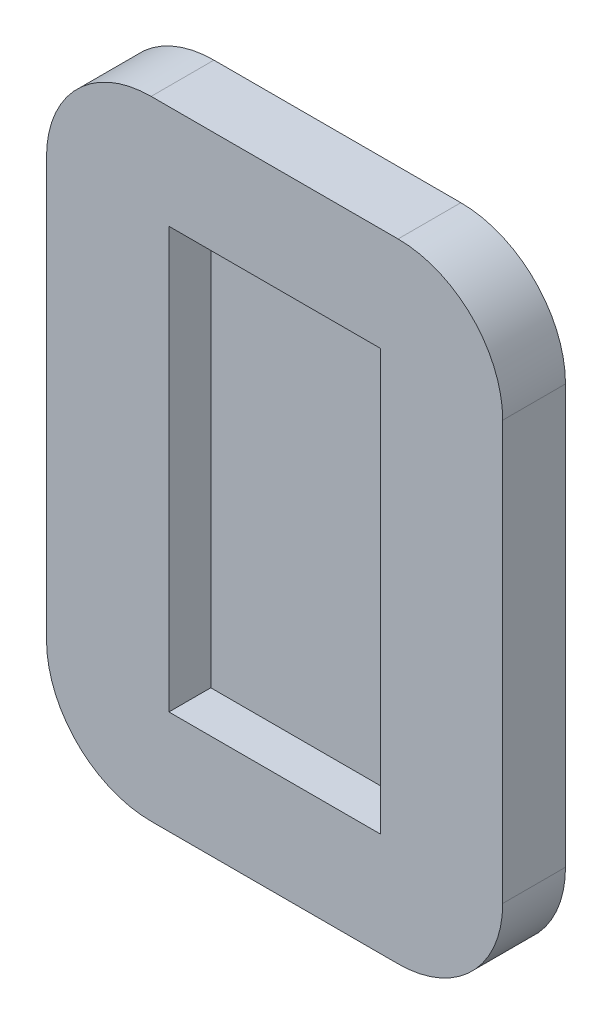
from build123d import *

# Parameters (mm, degrees)
CROQUIS1_W                        = 21.8
CROQUIS1_H                        = 30
SALIENTE_EXTRUIR1_DEPTH           = 21.8
CROQUIS6_R                        = 2
CORTAR_EXTRUIR2_DEPTH             = 21.8
CORTAR_EXTRUIR4_REACH             = 45.017
CROQUIS11_R                       = 3.5
CROQUIS11_W                       = 3.4
CROQUIS11_H                       = 8.4
CORTAR_EXTRUIR4_DIRECTION_2_DEPTH = 3.5
REDONDEO1_R                       = 5
CROQUIS13_R                       = 3.5
CORTAR_EXTRUIR6_DEPTH             = 3.5
CROQUIS16_W                       = 10.1
CROQUIS16_H                       = 20.1
CORTAR_EXTRUIR7_DEPTH             = 2
CROQUIS17_W                       = 10.1
CROQUIS17_H                       = 20.1
CORTAR_EXTRUIR8_DEPTH             = 2.1
CORTAR_EXTRUIR9_START             = -3.5
CROQUIS7_R                        = 3.5
CORTAR_EXTRUIR9_DEPTH             = 3.5
CORTAR_EXTRUIR10_REACH            = 45.017
CROQUIS18_W                       = 18.8
CROQUIS18_H                       = 30


with BuildPart() as part:
    # Croquis1 → Saliente-Extruir1 (new body)
    with BuildSketch(Plane(origin=(0, 0, 0), x_dir=(0, 0, -1), z_dir=(1, 0, 0))):
        with Locations((-10.9, -15)):
            Rectangle(CROQUIS1_W, CROQUIS1_H)
    extrude(amount=SALIENTE_EXTRUIR1_DEPTH)

    # Croquis6 → Cortar-Extruir2 (cut)
    with BuildSketch(Plane.ZY):
        with Locations((10.9, -22)):
            Circle(CROQUIS6_R)
        with Locations((10.9, -7)):
            Circle(CROQUIS6_R)
    extrude(amount=-CORTAR_EXTRUIR2_DEPTH, mode=Mode.SUBTRACT)

    # Cortar-Extruir4: up to this face of the body (flat: up to its plane)
    cortar_extruir4_end = Plane(part.part.faces().sort_by_distance((10.9, 0, 10.9))[0])
    # Croquis11 → Cortar-Extruir4 (cut, up to the picked face)
    with BuildSketch(Plane.XZ.offset(30), mode=Mode.PRIVATE) as cortar_extruir4_sk1:
        with Locations(Location((13.4, 10.9, 0), (0, 0, 270))):
            Circle(CROQUIS11_R)
    cortar_extruir4_tool1 = split(extrude(cortar_extruir4_sk1.sketch, amount=-CORTAR_EXTRUIR4_REACH, mode=Mode.PRIVATE), bisect_by=cortar_extruir4_end, keep=Keep.BOTH, mode=Mode.PRIVATE)
    # Croquis11 → Cortar-Extruir4 (cut, up to the picked face)
    with BuildSketch(Plane.XZ.offset(30), mode=Mode.PRIVATE) as cortar_extruir4_sk2:
        with Locations((7.2, 10.9)):
            Rectangle(CROQUIS11_W, CROQUIS11_H)
    cortar_extruir4_tool2 = split(extrude(cortar_extruir4_sk2.sketch, amount=-CORTAR_EXTRUIR4_REACH, mode=Mode.PRIVATE), bisect_by=cortar_extruir4_end, keep=Keep.BOTH, mode=Mode.PRIVATE)
    add(cortar_extruir4_tool1.solids().sort_by(Axis((13.4, -30, 10.9), (0, 1, 0)))[0], mode=Mode.SUBTRACT)
    add(cortar_extruir4_tool2.solids().sort_by(Axis((7.2, -30, 10.9), (0, 1, 0)))[0], mode=Mode.SUBTRACT)

    # Croquis11 → Cortar-Extruir4 direction 2 (cut)
    with BuildSketch(Plane.XZ.offset(30)):
        with Locations(Location((13.4, 10.9, 0), (0, 0, 270))):
            Circle(CROQUIS11_R)
        with Locations((7.2, 10.9)):
            Rectangle(CROQUIS11_W, CROQUIS11_H)
    extrude(amount=CORTAR_EXTRUIR4_DIRECTION_2_DEPTH, mode=Mode.SUBTRACT)

    # Redondeo1
    # the kernel refuses this fillet: 5 mm, written as the material it takes off along each edge
    with BuildSketch(Plane(origin=(21.8, -30, 34.3), x_dir=(0, 1, 0), z_dir=(0, 0, -1)), Plane(origin=(0, 0, -12.5), x_dir=(1, 0, 0), z_dir=(0, 0, 1))) as redondeo1_piece_1:
        with BuildLine():
            CenterArc((REDONDEO1_R, -REDONDEO1_R), REDONDEO1_R, 90, 90)
            Line((0, -REDONDEO1_R), (0, 0))
            Line((0, 0), (REDONDEO1_R, 0))
        make_face()
    extrude(amount=46.8, mode=Mode.SUBTRACT)
    with BuildSketch(Plane(origin=(21.8, 0, -12.5), x_dir=(-1, 0, 0), z_dir=(0, 0, 1)), Plane(origin=(0, -30, 34.3), x_dir=(0, 1, 0), z_dir=(0, 0, -1))) as redondeo1_piece_2:
        with BuildLine():
            CenterArc((REDONDEO1_R, REDONDEO1_R), REDONDEO1_R, 180, 90)
            Line((0, REDONDEO1_R), (0, 0))
            Line((0, 0), (REDONDEO1_R, 0))
        make_face()
    extrude(amount=46.8, mode=Mode.SUBTRACT)

    # Croquis13 → Cortar-Extruir6 (cut)
    with BuildSketch(Plane.ZY):
        with Locations((10.9, -7)):
            Circle(CROQUIS13_R)
        with Locations(Location((10.9, -22, 0), (0, 0, 301.002719134))):
            Circle(CROQUIS13_R)
    extrude(amount=-CORTAR_EXTRUIR6_DEPTH, mode=Mode.SUBTRACT)

    # Croquis16 → Cortar-Extruir7 (cut)
    with BuildSketch(Plane.XY.offset(21.8)):
        with Locations((10.9, -15)):
            Rectangle(CROQUIS16_W, CROQUIS16_H)
    extrude(amount=-CORTAR_EXTRUIR7_DEPTH, mode=Mode.SUBTRACT)

    # Croquis17 → Cortar-Extruir8 (cut)
    with BuildSketch(Plane(origin=(0, 0, 0), x_dir=(-1, 0, 0), z_dir=(0, 0, -1))):
        with Locations((-10.9, -15)):
            Rectangle(CROQUIS17_W, CROQUIS17_H)
    extrude(amount=-CORTAR_EXTRUIR8_DEPTH, mode=Mode.SUBTRACT)

    # Croquis7 → Cortar-Extruir9 (cut)
    with BuildSketch(Plane(origin=(21.8, 0, 0), x_dir=(0, 0, -1), z_dir=(1, 0, 0)).offset(CORTAR_EXTRUIR9_START)):
        with Locations(Location((-10.9, -22, 0), (0, 0, 238.997280866))):
            Circle(CROQUIS7_R)
        with Locations(Location((-10.9, -7, 0), (0, 0, 180))):
            Circle(CROQUIS7_R)
    extrude(amount=CORTAR_EXTRUIR9_DEPTH, mode=Mode.SUBTRACT)

    # Cortar-Extruir10: up to this face of the body (flat: up to its plane)
    cortar_extruir10_end = Plane(part.part.faces().sort_by_distance((21.8, -14.963855914, 10.9))[0])
    # Croquis18 → Cortar-Extruir10 (cut, up to the picked face)
    with BuildSketch(Plane.ZY, mode=Mode.PRIVATE) as cortar_extruir10_sk1:
        with Locations((9.4, -15)):
            Rectangle(CROQUIS18_W, CROQUIS18_H)
    cortar_extruir10_tool1 = split(extrude(cortar_extruir10_sk1.sketch, amount=-CORTAR_EXTRUIR10_REACH, mode=Mode.PRIVATE), bisect_by=cortar_extruir10_end, keep=Keep.BOTH, mode=Mode.PRIVATE)
    add(cortar_extruir10_tool1.solids().sort_by(Axis((0, -15, 9.4), (1, 0, 0)))[0], mode=Mode.SUBTRACT)


solid = part.part
